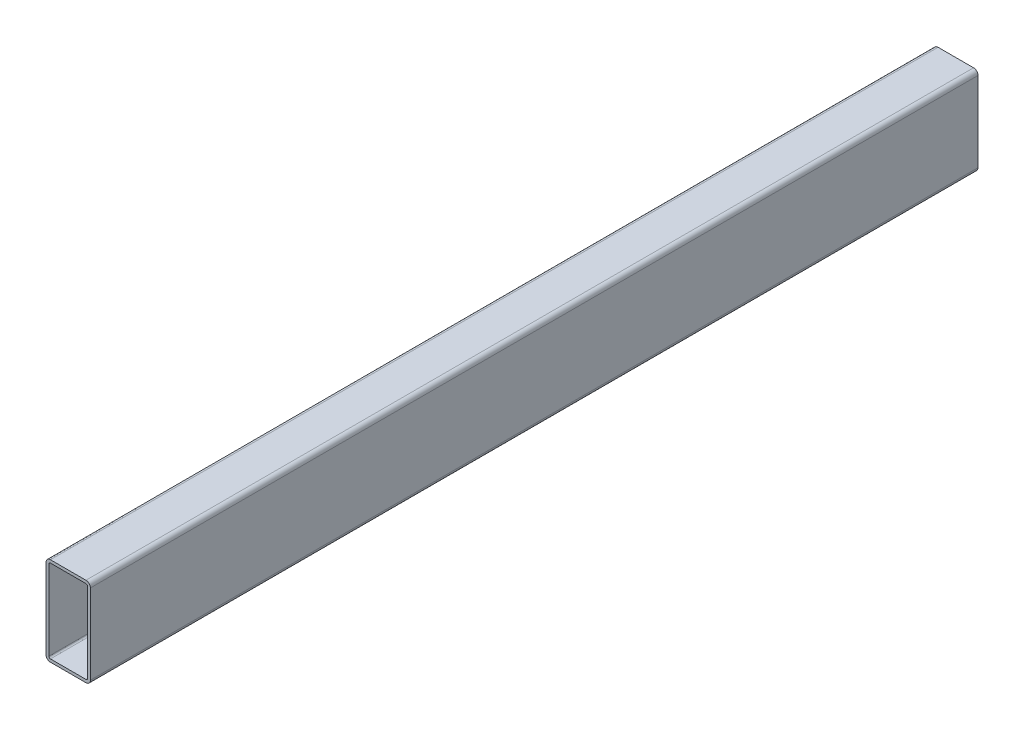
from build123d import *

# Parameters (mm, degrees)
EXTRUDE_THIN1_DEPTH = 508


with BuildPart() as part:
    # Sketch1 → Extrude-Thin1 (new body)
    with BuildSketch(Plane.XY):
        with BuildLine():
            Line((-10.16, 25.4), (10.16, 25.4))
            ThreePointArc((10.16, 25.4), (11.956051224, 24.656051224), (12.7, 22.86))
            Line((12.7, 22.86), (12.7, -22.86))
            ThreePointArc((12.7, -22.86), (11.956051224, -24.656051224), (10.16, -25.4))
            Line((10.16, -25.4), (-10.16, -25.4))
            ThreePointArc((-10.16, -25.4), (-11.956051224, -24.656051224), (-12.7, -22.86))
            Line((-12.7, -22.86), (-12.7, 22.86))
            ThreePointArc((-12.7, 22.86), (-11.956051224, 24.656051224), (-10.16, 25.4))
        make_face()
        with BuildLine():
            Line((-10.16, 23.749), (10.16, 23.749))
            ThreePointArc((10.16, 23.749), (10.788617928, 23.488617928), (11.049, 22.86))
            Line((11.049, 22.86), (11.049, -22.86))
            ThreePointArc((11.049, -22.86), (10.788617928, -23.488617928), (10.16, -23.749))
            Line((10.16, -23.749), (-10.16, -23.749))
            ThreePointArc((-10.16, -23.749), (-10.788617928, -23.488617928), (-11.049, -22.86))
            Line((-11.049, -22.86), (-11.049, 22.86))
            ThreePointArc((-11.049, 22.86), (-10.788617928, 23.488617928), (-10.16, 23.749))
        make_face(mode=Mode.SUBTRACT)
    extrude(amount=EXTRUDE_THIN1_DEPTH)


solid = part.part
